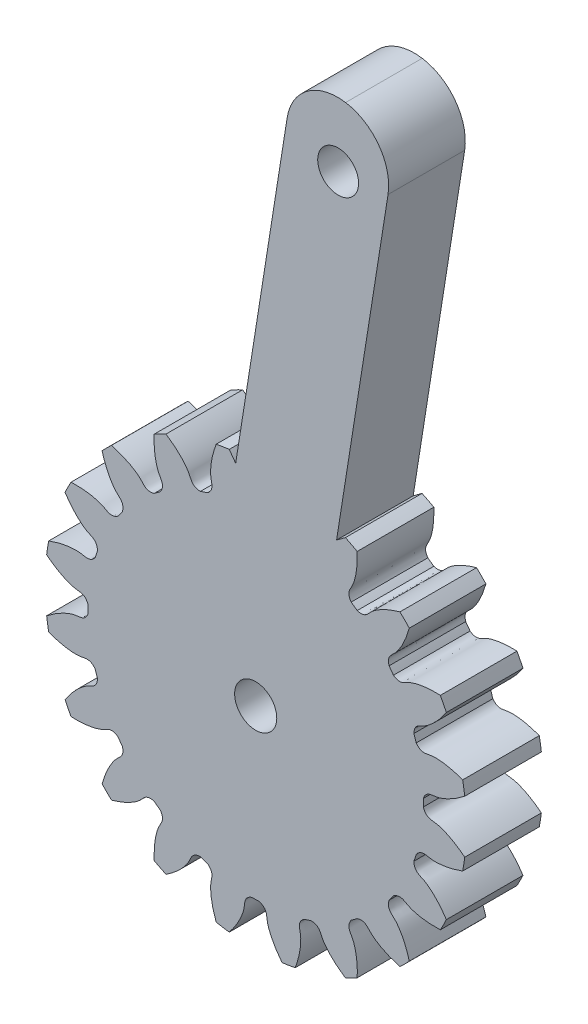
from build123d import *

# Parameters (mm, degrees)
SKETCH_1_R               = 16.5
EXTRUDE_1_DEPTH          = 6
CUT_EXTRUDE_1_DEPTH      = 25.093567606
PATTERN_CIRCULAR_1_COUNT = 20
SKETCH_5_R               = 10.75
CUT_EXTRUDE_2_DEPTH      = 3
SKETCH_6_R               = 5
CUT_EXTRUDE_3_DEPTH      = 3
SKETCH_7_R               = 0.75
CUT_EXTRUDE_4_DEPTH      = 3
SKETCH_8_R               = 10.75
EXTRUDE_2_DEPTH          = 3
EXTRUDE_3_DEPTH          = 6
SKETCH_11_R              = 1.65
CUT_EXTRUDE_6_DEPTH      = 10
SKETCH_12_R              = 8.713143254
SKETCH_12_R_2            = 1.65
EXTRUDE_4_DEPTH          = 6
SKETCH_13_R              = 1.6
CUT_EXTRUDE_7_DEPTH      = 10
FILLET_1_R               = 4


with BuildPart() as part:
    # 草图1 → 凸台-拉伸1 (new body)
    with BuildSketch(Plane.XY):
        Circle(SKETCH_1_R)
    extrude(amount=EXTRUDE_1_DEPTH)

    # 草图2 → 切除-拉伸1 (cut, through all)
    with BuildSketch(Plane.XY):
        with BuildLine():
            ThreePointArc((0.289974901, 13.121796354), (0, 13.125), (-0.289974901, 13.121796354))
            add(Edge.make_bspline(
                [(-0.289974901, 13.121796354), (-0.916784107, 13.340213268), (-0.835626149, 13.780670548), (-0.919345585, 14.205014104), (-0.928338279, 14.246334921), (-0.939466335, 14.292951923), (-0.952938145, 14.344795254), (-0.96896871, 14.401787245), (-0.987768083, 14.463844242), (-1.009544807, 14.5308761), (-1.034504625, 14.602786421), (-1.06285065, 14.679472568), (-1.094783098, 14.760825751), (-1.130499153, 14.846731096), (-1.170192797, 14.937067727), (-1.214054647, 15.031708847), (-1.2622718, 15.130521826), (-1.315027675, 15.233368292), (-1.372501858, 15.340104225), (-1.434869948, 15.450580056), (-1.502303414, 15.564640771), (-1.574969439, 15.682126017), (-1.653030782, 15.802870208), (-1.736645634, 15.926702646), (-1.825967477, 16.05344763), (-1.921144951, 16.182924586), (-2.022321721, 16.314948181), (-2.129636342, 16.449328459), (-2.24322214, 16.585870967), (-2.363207078, 16.724376892), (-2.489713645, 16.864643194), (-2.622858733, 17.006462752), (-2.762753527, 17.149624504), (-2.909503389, 17.29391359), (-3.06320776, 17.439111509), (-3.223960048, 17.584996263), (-3.391847534, 17.731342516), (-3.566951278, 17.877921749), (-3.749346018, 18.024502419), (-3.939100102, 18.170850122), (-4.136275349, 18.31672776), (-4.412210386, 18.512459802), (-4.625898619, 18.654498902), (-4.771736973, 18.747377789)],
                knots=[0, 0, 0, 0, 0.165916003, 0.170905922, 0.176663519, 0.183188797, 0.190481754, 0.198542391, 0.207370708, 0.216966704, 0.22733038, 0.238461736, 0.250360771, 0.263027487, 0.276461881, 0.290663956, 0.30563371, 0.321371144, 0.337876258, 0.355149051, 0.373189524, 0.391997677, 0.411573509, 0.431917021, 0.453028213, 0.474907084, 0.497553636, 0.520967867, 0.545149777, 0.570099367, 0.595816637, 0.622301587, 0.649554216, 0.677574526, 0.706362514, 0.735918183, 0.766241531, 0.797332559, 0.829191267, 0.861817654, 0.895211721, 0.929373468, 1, 1, 1, 1], degree=3))
            ThreePointArc((-4.771736973, 18.747377789), (0, 19.345119481), (4.771736973, 18.747377789))
            add(Edge.make_bspline(
                [(0.289974901, 13.121796354), (0.916784107, 13.340213268), (0.835626149, 13.780670548), (0.919345585, 14.205014104), (0.928338279, 14.246334921), (0.939466335, 14.292951923), (0.952938145, 14.344795254), (0.96896871, 14.401787245), (0.987768083, 14.463844242), (1.009544807, 14.5308761), (1.034504625, 14.602786421), (1.06285065, 14.679472568), (1.094783098, 14.760825751), (1.130499153, 14.846731096), (1.170192797, 14.937067727), (1.214054647, 15.031708847), (1.2622718, 15.130521826), (1.315027675, 15.233368292), (1.372501858, 15.340104225), (1.434869948, 15.450580056), (1.502303414, 15.564640771), (1.574969439, 15.682126017), (1.653030782, 15.802870208), (1.736645634, 15.926702646), (1.825967477, 16.05344763), (1.921144951, 16.182924586), (2.022321721, 16.314948181), (2.129636342, 16.449328459), (2.24322214, 16.585870967), (2.363207078, 16.724376892), (2.489713645, 16.864643194), (2.622858733, 17.006462752), (2.762753527, 17.149624504), (2.909503389, 17.29391359), (3.06320776, 17.439111509), (3.223960048, 17.584996263), (3.391847534, 17.731342516), (3.566951278, 17.877921749), (3.749346018, 18.024502419), (3.939100102, 18.170850122), (4.136275349, 18.31672776), (4.412210386, 18.512459802), (4.625898619, 18.654498902), (4.771736973, 18.747377789)],
                knots=[0, 0, 0, 0, 0.165916003, 0.170905922, 0.176663519, 0.183188797, 0.190481754, 0.198542391, 0.207370708, 0.216966704, 0.22733038, 0.238461736, 0.250360771, 0.263027487, 0.276461881, 0.290663956, 0.30563371, 0.321371144, 0.337876258, 0.355149051, 0.373189524, 0.391997677, 0.411573509, 0.431917021, 0.453028213, 0.474907084, 0.497553636, 0.520967867, 0.545149777, 0.570099367, 0.595816637, 0.622301587, 0.649554216, 0.677574526, 0.706362514, 0.735918183, 0.766241531, 0.797332559, 0.829191267, 0.861817654, 0.895211721, 0.929373468, 1, 1, 1, 1], degree=3))
        make_face()
    cut_extrude_1 = extrude(amount=CUT_EXTRUDE_1_DEPTH, mode=Mode.SUBTRACT)

    # 阵列(圆周)1: 切除-拉伸1 ×20 about axis
    pattern_circular_1_axis = Axis((0, 0, -0.3), (0, 0, 1))
    for i in range(1, PATTERN_CIRCULAR_1_COUNT):
        add(cut_extrude_1.rotate(pattern_circular_1_axis, i * 360 / PATTERN_CIRCULAR_1_COUNT), mode=Mode.SUBTRACT)

    # 草图5 → 切除-拉伸2 (cut)
    with BuildSketch(Plane(origin=(0, 0, 0), x_dir=(-1, 0, 0), z_dir=(0, 0, -1))):
        Circle(SKETCH_5_R)
    extrude(amount=-CUT_EXTRUDE_2_DEPTH, mode=Mode.SUBTRACT)

    # 草图6 → 切除-拉伸3 (cut)
    with BuildSketch(Plane(origin=(0, 0, 3), x_dir=(-1, 0, 0), z_dir=(0, 0, -1))):
        Circle(SKETCH_6_R)
    extrude(amount=-CUT_EXTRUDE_3_DEPTH, mode=Mode.SUBTRACT)

    # 草图7 → 切除-拉伸4 (cut)
    with BuildSketch(Plane(origin=(0, 0, 3), x_dir=(-1, 0, 0), z_dir=(0, 0, -1))):
        with Locations((0, 7.25)):
            Circle(SKETCH_7_R)
        with Locations((7.25, 0)):
            Circle(SKETCH_7_R)
        with Locations(Location((0, -7.25, 0), (0, 0, 180))):
            Circle(SKETCH_7_R)
        with Locations(Location((-7.25, 0, 0), (0, 0, 180))):
            Circle(SKETCH_7_R)
    extrude(amount=-CUT_EXTRUDE_4_DEPTH, mode=Mode.SUBTRACT)

    # 草图8 → 凸台-拉伸2 (add)
    with BuildSketch(Plane(origin=(0, 0, 0), x_dir=(-1, 0, 0), z_dir=(0, 0, -1))):
        Circle(SKETCH_8_R)
    extrude(amount=-EXTRUDE_2_DEPTH)

    # 草图9 → 凸台-拉伸3 (add)
    with BuildSketch(Plane.XY.offset(6)):
        Polygon((-2.038970697, 12.696258561), (5.862536028, 11.444782841), (11.772476614, 48.75867917), (3.87096989, 50.01015489), align=None)
    extrude(amount=-EXTRUDE_3_DEPTH)

    # 草图11 → 切除-拉伸6 (cut)
    with BuildSketch(Plane.XY.offset(3)):
        Circle(SKETCH_11_R)
    extrude(amount=-CUT_EXTRUDE_6_DEPTH, mode=Mode.SUBTRACT)

    # 草图12 → 凸台-拉伸4 (add)
    with BuildSketch(Plane.XY.offset(6)):
        Circle(SKETCH_12_R)
        Circle(SKETCH_12_R_2, mode=Mode.SUBTRACT)
    extrude(amount=-EXTRUDE_4_DEPTH)

    # 草图13 → 切除-拉伸7 (cut)
    with BuildSketch(Plane.XY.offset(6)):
        with Locations((6.456797228, 39.475432481)):
            Circle(SKETCH_13_R)
        Polygon((3.87096989, 50.01015489), (11.772476614, 48.75867917), (10.990224511, 43.819733767), (3.088717786, 45.071209487), align=None)
    extrude(amount=-CUT_EXTRUDE_7_DEPTH, mode=Mode.SUBTRACT)

    # 圆角1
    fillet_1_edges = [part.edges().sort_by_distance(p)[0] for p in [
        (10.990224511, 43.819733767, 3),
        (3.088717786, 45.071209487, 3),
    ]]
    fillet(fillet_1_edges, radius=FILLET_1_R - 0.0001)  # a hair under: the kernel refuses the full size


solid = part.part
